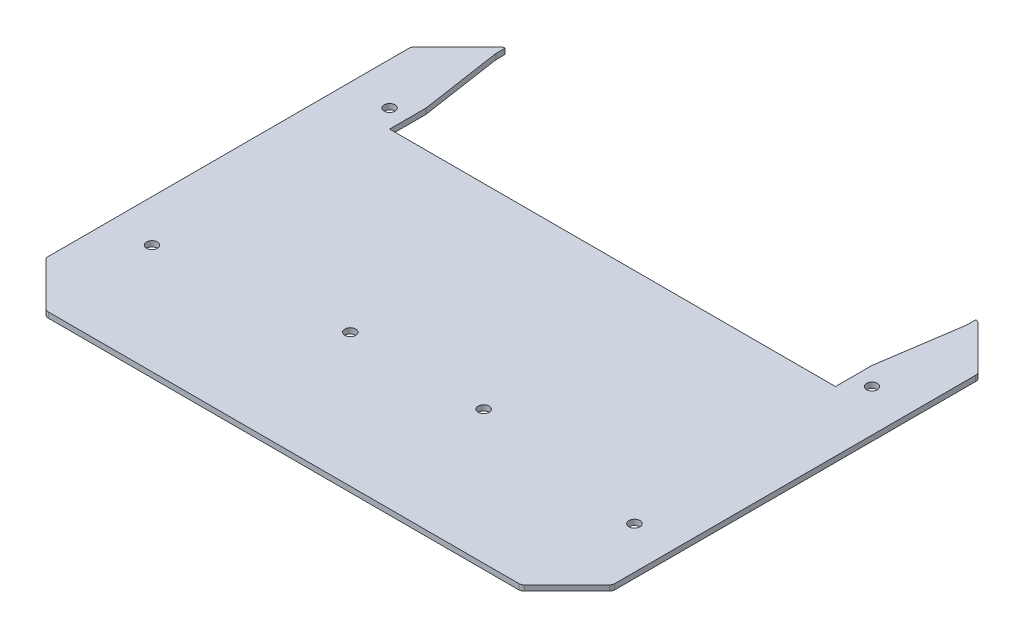
from build123d import *

# Parameters (mm, degrees)
BOSS_EXTRU_1_DEPTH      = 3
CONG_1_R                = 3
ESQUISSE2_R             = 3
PER_AGE_PROFIL_DEPTH    = 200.145675323
ESQUISSE3_R             = 3
ENL_V_MAT_EXTRU_1_DEPTH = 200.145675323
ENL_V_MAT_EXTRU_2_REACH = 201.146


with BuildPart() as part:
    # Esquisse1 → Boss.-Extru.1 (new body)
    with BuildSketch(Plane(origin=(0, 0, 0), x_dir=(1, 0, 0), z_dir=(0, 1, 0))):
        Polygon((-130, 125), (130, 125), (155, 100), (155, -100), (130, -125), (-130, -125), (-155, -100), (-155, 100), align=None)
    extrude(amount=BOSS_EXTRU_1_DEPTH)

    # Congé1
    cong_1_edges = [part.edges().sort_by_distance(p)[0] for p in [
        (-130, 1.5, 125),
        (-155, 1.5, 100),
        (130, 1.5, 125),
        (155, 1.5, 100),
        (155, 1.5, -100),
        (130, 1.5, -125),
        (-130, 1.5, -125),
        (-155, 1.5, -100),
    ]]
    fillet(cong_1_edges, radius=CONG_1_R)

    # Esquisse2 → Perçage Profilé (cut, through all)
    with BuildSketch(Plane(origin=(0, 3, 0), x_dir=(1, 0, 0), z_dir=(0, 1, 0))):
        with Locations((-132, 65)):
            Circle(ESQUISSE2_R)
        with Locations((-132, -65)):
            Circle(ESQUISSE2_R)
        with Locations((132, -65)):
            Circle(ESQUISSE2_R)
        with Locations((132, 65)):
            Circle(ESQUISSE2_R)
    extrude(amount=-PER_AGE_PROFIL_DEPTH, mode=Mode.SUBTRACT)

    # Esquisse3 → Enlèv. mat.-Extru.1 (cut, through all)
    with BuildSketch(Plane(origin=(0, 3, 0), x_dir=(1, 0, 0), z_dir=(0, 1, 0))):
        with Locations((-36.5, -52)):
            Circle(ESQUISSE3_R)
        with Locations((36.5, -52)):
            Circle(ESQUISSE3_R)
    extrude(amount=-ENL_V_MAT_EXTRU_1_DEPTH, mode=Mode.SUBTRACT)

    # Esquisse4 → Enlèv. mat.-Extru.2 (cut, up to next)
    with BuildSketch(Plane(origin=(0, 3, 0), x_dir=(1, 0, 0), z_dir=(0, 1, 0)), mode=Mode.PRIVATE) as enl_v_mat_extru_2_sk1:
        Polygon((122, 55), (-122, 55), (-122, 75), (-128.757359313, 120), (-128.757359313, 125), (128.757359313, 125), (128.757359313, 120), (122, 75), align=None)
    enl_v_mat_extru_2_tool1 = extrude(enl_v_mat_extru_2_sk1.sketch, amount=-ENL_V_MAT_EXTRU_2_REACH, mode=Mode.PRIVATE) & part.part
    add(enl_v_mat_extru_2_tool1.solids().sort_by_distance((0, 3, -90.387205))[0], mode=Mode.SUBTRACT)


solid = part.part
